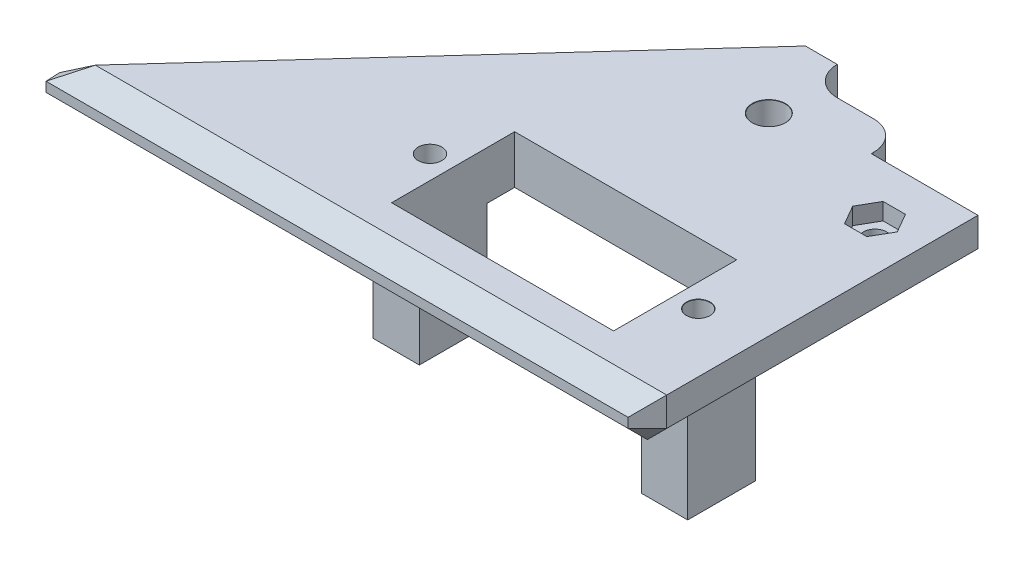
from build123d import *

# Parameters (mm, degrees)
BOSS_EXTRUDE1_DEPTH            = 5
M3_CLEARANCE_HOLE1_D           = 3.4
M3_CLEARANCE_HOLE1_CSINK_D     = 3.45
M3_CLEARANCE_HOLE1_CSINK_ANGLE = 90
SKETCH4_W                      = 40
SKETCH4_H                      = 25
BOSS_EXTRUDE2_DEPTH            = 5
SKETCH5_W                      = 8.058679656
SKETCH5_H                      = 6
BOSS_EXTRUDE3_DEPTH            = 5
SKETCH8_W                      = 23
SKETCH8_H                      = 12.75
CUT_EXTRUDE1_DEPTH             = 5
M2_CLEARANCE_HOLE1_D           = 2.4
M2_CLEARANCE_HOLE1_CSINK_D     = 2.45
M2_CLEARANCE_HOLE1_CSINK_ANGLE = 90
SKETCH11_W                     = 4.8
SKETCH11_H                     = 7
BOSS_EXTRUDE4_DEPTH            = 11
CUT_EXTRUDE2_DEPTH             = 1.75
SKETCH13_R                     = 1.225
SKETCH13_R_2                   = 1.2
CUT_EXTRUDE3_DEPTH             = 14.25
M2_CLEARANCE_HOLE2_D           = 2.4
M2_CLEARANCE_HOLE2_DEPTH       = 5
M2_CLEARANCE_HOLE2_CSINK_D     = 2.45
M2_CLEARANCE_HOLE2_CSINK_ANGLE = 90
M2_CLEARANCE_HOLE2_TIP         = 0.721032743
CUT_EXTRUDE4_DEPTH             = 1.75
BOSS_EXTRUDE5_START            = -5
BOSS_EXTRUDE5_DEPTH            = 5
CHAMFER2_SIZE                  = 2


with BuildPart() as part:
    # Sketch1 → Boss-Extrude1 (new body)
    with BuildSketch(Plane(origin=(0, 0, 0), x_dir=(1, 0, 0), z_dir=(0, 1, 0))):
        with BuildLine():
            Line((-3, 0), (-9, 0))
            Line((-9, 0), (-9, -15.5))
            Line((-9, -15.5), (9.77, -15.5))
            Line((9.77, -15.5), (9.77, -9.5))
            ThreePointArc((9.77, -9.5), (7.648679656, -8.621320344), (6.77, -6.5))
            Line((6.77, -6.5), (6.77, -6))
            ThreePointArc((6.77, -6), (5.891320344, -3.878679656), (3.77, -3))
            Line((3.77, -3), (0, -3))
            ThreePointArc((0, -3), (-2.121320344, -2.121320344), (-3, 0))
        make_face()
    extrude(amount=BOSS_EXTRUDE1_DEPTH)

    # M3 Clearance Hole1 (through all)
    with Locations(Plane(origin=(0, 5, 0), x_dir=(1, 0, 0), z_dir=(0, 1, 0))):
        with Locations((-2.171320344, -7.921320344)):
            CounterSinkHole(M3_CLEARANCE_HOLE1_D / 2, M3_CLEARANCE_HOLE1_CSINK_D / 2, counter_sink_angle=M3_CLEARANCE_HOLE1_CSINK_ANGLE)

    # Sketch4 → Boss-Extrude2 (add)
    with BuildSketch(Plane(origin=(0, 5, 0), x_dir=(1, 0, 0), z_dir=(0, 1, 0))):
        with Locations((-2.171320344, -28)):
            Rectangle(SKETCH4_W, SKETCH4_H)
    extrude(amount=-BOSS_EXTRUDE2_DEPTH)

    # Sketch5 → Boss-Extrude3 (add)
    with BuildSketch(Plane(origin=(0, 5, 0), x_dir=(1, 0, 0), z_dir=(0, 1, 0))):
        with Locations((13.799339828, -12.5)):
            Rectangle(SKETCH5_W, SKETCH5_H)
        Polygon((-9, 0), (-45.89, -40.5), (-22.171320344, -40.5), (-22.171320344, -15.5), (-9, -15.5), align=None)
    extrude(amount=-BOSS_EXTRUDE3_DEPTH)

    # Sketch8 → Cut-Extrude1 (cut)
    with BuildSketch(Plane(origin=(0, 5, 0), x_dir=(1, 0, 0), z_dir=(0, 1, 0))):
        with Locations((-2.171320344, -29.125)):
            Rectangle(SKETCH8_W, SKETCH8_H)
    extrude(amount=-CUT_EXTRUDE1_DEPTH, mode=Mode.SUBTRACT)

    # M2 Clearance Hole1 (through all)
    with Locations(Plane(origin=(0, 5, 0), x_dir=(1, 0, 0), z_dir=(0, 1, 0))):
        with Locations((-16.071320344, -29.125), (11.728679656, -29.125)):
            CounterSinkHole(M2_CLEARANCE_HOLE1_D / 2, M2_CLEARANCE_HOLE1_CSINK_D / 2, counter_sink_angle=M2_CLEARANCE_HOLE1_CSINK_ANGLE)

    # Sketch11 → Boss-Extrude4 (add)
    with BuildSketch(Plane.XZ):
        with Locations((-16.071320344, 29.125)):
            Rectangle(SKETCH11_W, SKETCH11_H)
        with Locations((11.728679656, 29.125)):
            Rectangle(SKETCH11_W, SKETCH11_H)
    extrude(amount=BOSS_EXTRUDE4_DEPTH)

    # Sketch12 → Cut-Extrude2 (cut)
    with BuildSketch(Plane.XZ.offset(11)):
        Polygon((-16.071320344, 26.815598923), (-14.071320344, 27.970299462), (-14.071320344, 30.279700538), (-16.071320344, 31.434401077), (-18.071320344, 30.279700538), (-18.071320344, 27.970299462), align=None)
        Polygon((11.728679656, 26.815598923), (13.728679656, 27.970299462), (13.728679656, 30.279700538), (11.728679656, 31.434401077), (9.728679656, 30.279700538), (9.728679656, 27.970299462), align=None)
    extrude(amount=-CUT_EXTRUDE2_DEPTH, mode=Mode.SUBTRACT)

    # Sketch13 → Cut-Extrude3 (cut)
    with BuildSketch(Plane.XZ.offset(9.25)):
        with Locations(Location((-16.071320344, 29.125, 0), (0, 0, 270))):
            Circle(SKETCH13_R)
        with Locations(Location((11.728679656, 29.125, 0), (0, 0, 90))):
            Circle(SKETCH13_R_2)
    extrude(amount=-CUT_EXTRUDE3_DEPTH, mode=Mode.SUBTRACT)

    # Chamfer1
    # the kernel refuses this chamfer: 2, 1.41575134 mm, written as the material it takes off along each edge
    with BuildSketch(Plane(origin=(16.495346323, 1.333333333, 39.166666667), x_dir=(0, 0.7071067811865475, 0.7071067811865475), z_dir=(0.5773502691896257, -0.5773502691896258, 0.5773502691896258))) as chamfer1_piece_1:
        Polygon((-1.414213562, 0.816496581), (1.414213562, 0.816496581), (0, -1.632993162), align=None)
    extrude(amount=2.540341184, mode=Mode.SUBTRACT)
    with BuildSketch(Plane(origin=(-43.46014374, 3.666666667, 39.340475196), x_dir=(-0.8384813090956955, -0.5273042113731956, 0.13747495395620568), z_dir=(-0.5292925924408943, 0.848080045562193, 0.024689834070442226))) as chamfer1_piece_2:
        Polygon((-2.577063376, -0.491006629), (1.215813595, -0.491006629), (1.361249781, 0.982013258), align=None)
    extrude(amount=2.690057467, mode=Mode.SUBTRACT)
    with BuildSketch(Plane(origin=(-43.46014374, 1.333333333, 39.340475196), x_dir=(0.04659618615065125, 0, 0.9989138078113716), z_dir=(-0.5292925924408943, -0.848080045562193, 0.02468983407044242))) as chamfer1_piece_3:
        Polygon((-0.369170259, 1.258174681), (1.111011916, 1.258174681), (-0.741841657, -2.516349362), align=None)
    extrude(amount=2.690057467, mode=Mode.SUBTRACT)
    with BuildSketch(Plane(origin=(17.828679656, 10.143365976, 40.5), x_dir=(-0.9996219169112968, 0, 0.027495876610585623), z_dir=(0, -1, 0)), Plane(origin=(17.828679656, 10.143365976, 9.5), x_dir=(0.027495876610585623, 0, 0.9996219169112968), z_dir=(0, -1, 0))) as chamfer1_piece_4:
        with BuildLine():
            Line((2.05734639, 0), (-0.11309431, 2.054235587))
            Line((-0.11309431, 2.054235587), (-0.153079186, 2.053135752))
            ThreePointArc((-0.153079186, 2.053135752), (-0.068258454, 1.026795659), (-0.039984877, -0.001099835))
            Line((-0.039984877, -0.001099835), (0.001099835, -0.039984877))
            ThreePointArc((0.001099835, -0.039984877), (1.028995329, -0.011711299), (2.058446225, -0.039984877))
            Line((2.058446225, -0.039984877), (2.05734639, 0))
        make_face()
    extrude(amount=15.286731952, mode=Mode.SUBTRACT)
    with BuildSketch(Plane(origin=(-51.033365976, 5, 40.5), x_dir=(0, 0.02749587661058651, -0.9996219169112968), z_dir=(1, 0, 0))) as chamfer1_piece_5:
        with BuildLine():
            Line((2.05734639, 0), (-0.11309431, -2.054235587))
            Line((-0.11309431, -2.054235587), (-0.153079186, -2.053135752))
            ThreePointArc((-0.153079186, -2.053135752), (-0.068258454, -1.026795659), (-0.039984877, 0.001099835))
            Line((-0.039984877, 0.001099835), (0.001099835, 0.039984877))
            ThreePointArc((0.001099835, 0.039984877), (1.028995329, 0.011711299), (2.058446225, 0.039984877))
            Line((2.058446225, 0.039984877), (2.05734639, 0))
        make_face()
    extrude(amount=74.005411608, mode=Mode.SUBTRACT)
    with BuildSketch(Plane(origin=(17.828679656, 0, 45.643365976), x_dir=(-0.9996219169112968, -0.027495876610586365, 0), z_dir=(0, 0, -1))) as chamfer1_piece_6:
        with BuildLine():
            Line((2.05734639, 0), (-0.11309431, 2.054235587))
            Line((-0.11309431, 2.054235587), (-0.153079186, 2.053135752))
            ThreePointArc((-0.153079186, 2.053135752), (-0.068258454, 1.026795659), (-0.039984877, -0.001099835))
            Line((-0.039984877, -0.001099835), (0.001099835, -0.039984877))
            ThreePointArc((0.001099835, -0.039984877), (1.028995329, -0.011711299), (2.058446225, -0.039984877))
            Line((2.058446225, -0.039984877), (2.05734639, 0))
        make_face()
    extrude(amount=41.286731952, mode=Mode.SUBTRACT)
    with BuildSketch(Plane(origin=(-51.033365976, 0, 40.5), x_dir=(0, -0.02749587661058639, -0.9996219169112968), z_dir=(1, 0, 0))) as chamfer1_piece_7:
        with BuildLine():
            Line((2.05734639, 0), (-0.11309431, 2.054235587))
            Line((-0.11309431, 2.054235587), (-0.153079186, 2.053135752))
            ThreePointArc((-0.153079186, 2.053135752), (-0.068258454, 1.026795659), (-0.039984877, -0.001099835))
            Line((-0.039984877, -0.001099835), (0.001099835, -0.039984877))
            ThreePointArc((0.001099835, -0.039984877), (1.028995329, -0.011711299), (2.058446225, -0.039984877))
            Line((2.058446225, -0.039984877), (2.05734639, 0))
        make_face()
    extrude(amount=74.005411608, mode=Mode.SUBTRACT)
    with BuildSketch(Plane(origin=(-5.536507509, 5, -3.802424665), x_dir=(0.7390076945383709, 0.02749587661058648, 0.673135650654827), z_dir=(-0.6733902481197388, 0, 0.7392872065288542))) as chamfer1_piece_8:
        with BuildLine():
            Line((2.05734639, 0), (-0.11309431, -2.054235587))
            Line((-0.11309431, -2.054235587), (-0.153079186, -2.053135752))
            ThreePointArc((-0.153079186, -2.053135752), (-0.068258454, -1.026795659), (-0.039984877, 0.001099835))
            Line((-0.039984877, 0.001099835), (0.001099835, 0.039984877))
            ThreePointArc((0.001099835, 0.039984877), (1.028995329, 0.011711299), (2.058446225, 0.039984877))
            Line((2.058446225, 0.039984877), (2.05734639, 0))
        make_face()
    extrude(amount=65.069230069, mode=Mode.SUBTRACT)
    with BuildSketch(Plane(origin=(-5.536507509, 0, -3.802424665), x_dir=(0.7390076945383709, -0.027495876610586358, 0.673135650654827), z_dir=(-0.6733902481197388, 0, 0.7392872065288542))) as chamfer1_piece_9:
        with BuildLine():
            Line((2.05734639, 0), (-0.11309431, 2.054235587))
            Line((-0.11309431, 2.054235587), (-0.153079186, 2.053135752))
            ThreePointArc((-0.153079186, 2.053135752), (-0.068258454, 1.026795659), (-0.039984877, -0.001099835))
            Line((-0.039984877, -0.001099835), (0.001099835, -0.039984877))
            ThreePointArc((0.001099835, -0.039984877), (1.028995329, -0.011711299), (2.058446225, -0.039984877))
            Line((2.058446225, -0.039984877), (2.05734639, 0))
        make_face()
    extrude(amount=65.069230069, mode=Mode.SUBTRACT)
    with BuildSketch(Plane(origin=(-45.89, 10.143365976, 40.5), x_dir=(0.6528083008443235, 0, -0.7575231497114442), z_dir=(0, -1, 0))) as chamfer1_piece_10:
        with BuildLine():
            Line((2.05734639, 0), (0.86611167, 1.127456168))
            Line((0.86611167, 1.127456168), (0.835810744, 1.1535685))
            ThreePointArc((0.835810744, 1.1535685), (0.433022923, 0.563756447), (-0.030300926, 0.026112332))
            Line((-0.030300926, 0.026112332), (0.001099835, -0.039984877))
            ThreePointArc((0.001099835, -0.039984877), (1.028995329, -0.011711299), (2.058446225, -0.039984877))
            Line((2.058446225, -0.039984877), (2.05734639, 0))
        make_face()
    extrude(amount=15.286731952, mode=Mode.SUBTRACT)

    # M2 Clearance Hole2
    with Locations(Plane(origin=(0, 5, 0), x_dir=(1, 0, 0), z_dir=(0, 1, 0))):
        with Locations((12.828679656, -11.921320344)):
            CounterSinkHole(M2_CLEARANCE_HOLE2_D / 2, M2_CLEARANCE_HOLE2_CSINK_D / 2, depth=M2_CLEARANCE_HOLE2_DEPTH, counter_sink_angle=M2_CLEARANCE_HOLE2_CSINK_ANGLE)
            with Locations((0, 0, -(M2_CLEARANCE_HOLE2_DEPTH + M2_CLEARANCE_HOLE2_TIP / 2))):  # 118° drill point
                Cone(0, M2_CLEARANCE_HOLE2_D / 2, M2_CLEARANCE_HOLE2_TIP, mode=Mode.SUBTRACT)

    # Sketch18 → Cut-Extrude4 (cut)
    with BuildSketch(Plane(origin=(0, 5, 0), x_dir=(1, 0, 0), z_dir=(0, 1, 0))):
        Polygon((11.673979118, -13.921320344), (13.983380195, -13.921320344), (15.138080733, -11.921320344), (13.983380195, -9.921320344), (11.673979118, -9.921320344), (10.51927858, -11.921320344), align=None)
    extrude(amount=-CUT_EXTRUDE4_DEPTH, mode=Mode.SUBTRACT)

    # Sketch19 → Boss-Extrude5 (add)
    with BuildSketch(Plane(origin=(0, 5, 0), x_dir=(1, 0, 0), z_dir=(0, 1, 0)).offset(BOSS_EXTRUDE5_START)):
        with BuildLine():
            Line((17.828679656, -6.25), (17.828679656, -11.5))
            Line((17.828679656, -11.5), (15.828679656, -9.5))
            Line((15.828679656, -9.5), (9.77, -9.5))
            ThreePointArc((9.77, -9.5), (7.648679656, -8.621320344), (6.77, -6.5))
            Line((6.77, -6.5), (6.77, -6.25))
            Line((6.77, -6.25), (17.828679656, -6.25))
        make_face()
    extrude(amount=BOSS_EXTRUDE5_DEPTH)

    # Chamfer2
    chamfer2_edges = [part.edges().sort_by_distance(p)[0] for p in [
        (17.828679656, 0, 8.875),
    ]]
    chamfer(chamfer2_edges, length=CHAMFER2_SIZE)


solid = part.part
